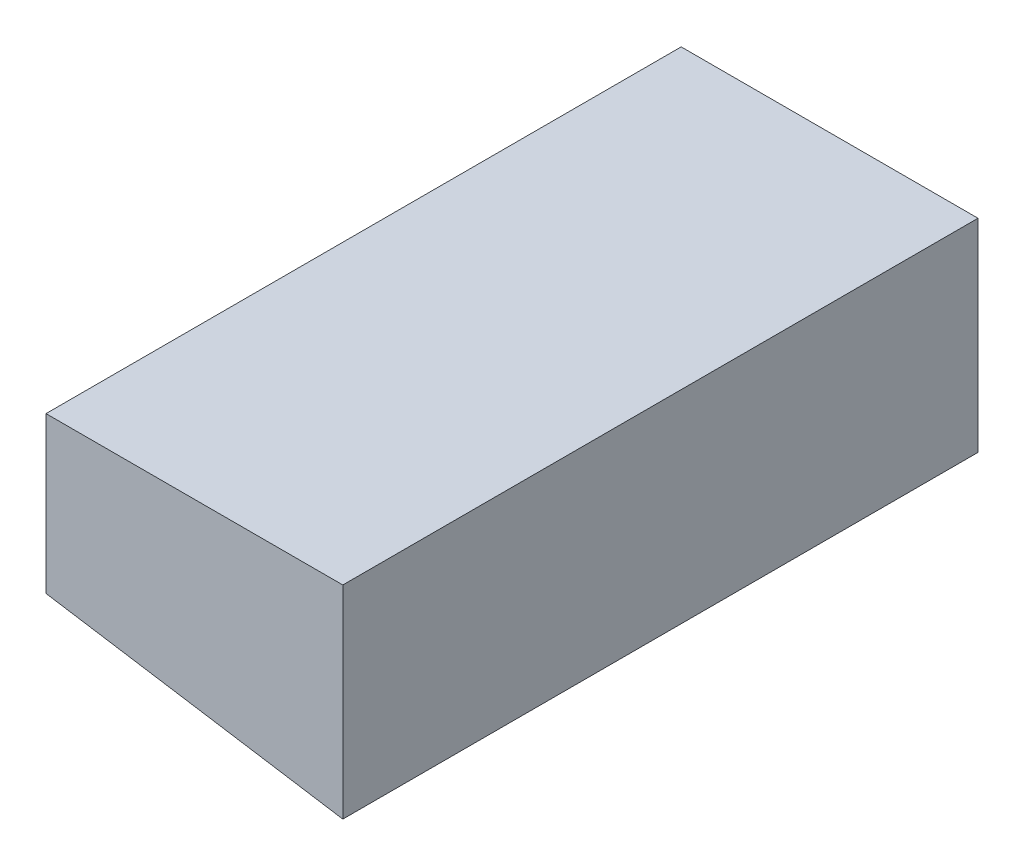
from build123d import *

# Parameters (mm, degrees)
SKETCH_1_W       = 50
SKETCH_1_H       = 107
EXTRUDE_1_DEPTH  = 50
CHAMFER_1_SIZE   = 23.757666049
CHAMFER_1_SIZE_2 = 150


with BuildPart() as part:
    # 草图1 → 凸台-拉伸1 (new body)
    with BuildSketch(Plane(origin=(0, 0, 0), x_dir=(1, 0, 0), z_dir=(0, 1, 0))):
        with Locations((-21.53514466, -30.394008033)):
            Rectangle(SKETCH_1_W, SKETCH_1_H)
    extrude(amount=EXTRUDE_1_DEPTH)

    # 倒角1
    # the kernel refuses this chamfer: 150, 23.757666049 mm, written as the material it takes off along each edge
    with BuildSketch(Plane(origin=(-46.53514466, 0, 473.716395579), x_dir=(-0.2333366369919579, 0.9723960169793392, 0), z_dir=(0, 0, -1))) as chamfer_1_piece_1:
        Polygon((CHAMFER_1_SIZE * 0.972396016966, CHAMFER_1_SIZE * 0.233336636989), (-CHAMFER_1_SIZE_2 * 0.233336636992, CHAMFER_1_SIZE_2 * 0.972396016979), (0, 0), align=None)
    extrude(amount=886.644775091, mode=Mode.SUBTRACT)


solid = part.part
